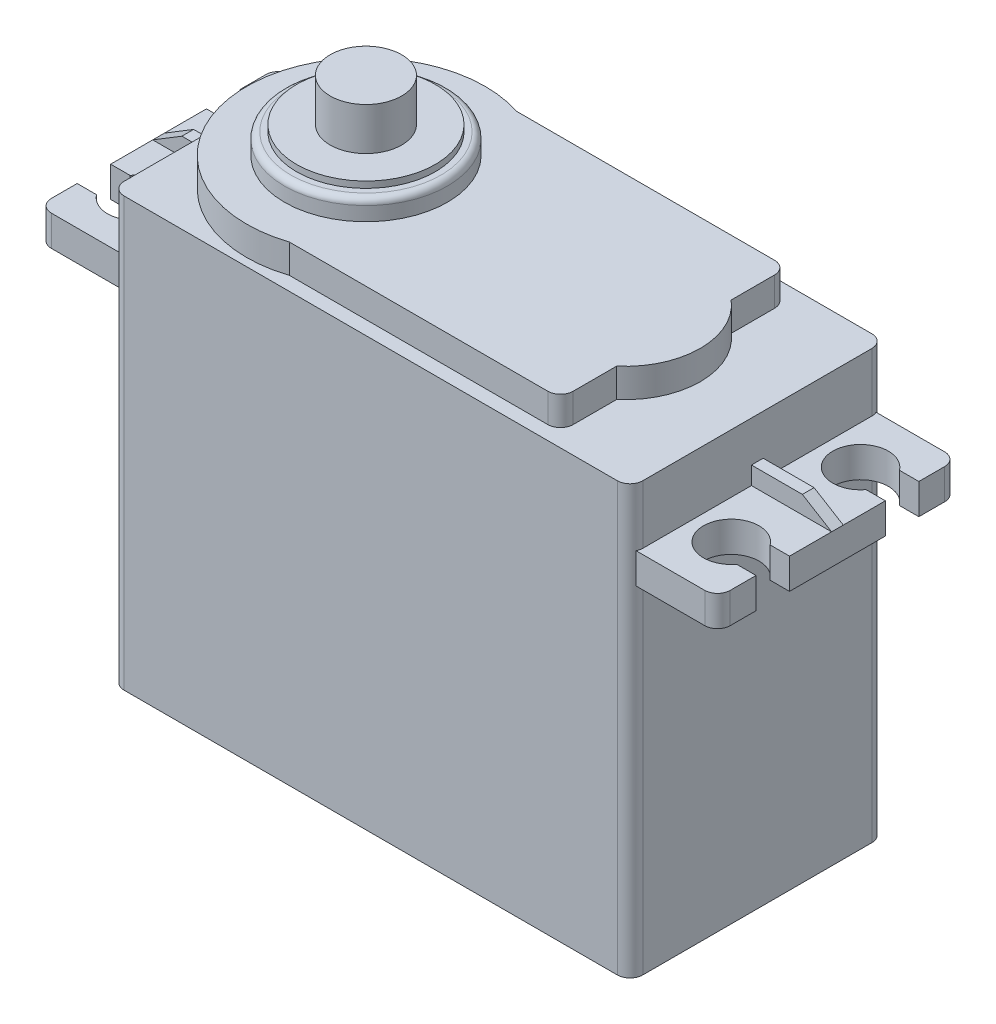
from build123d import *

# Parameters (mm, degrees)
SKETCH1_W            = 40.75
SKETCH1_H            = 33.63
BOSS_EXTRUDE1_DEPTH  = 10
BOSS_EXTRUDE2_DEPTH  = 2.27
SKETCH3_R            = 6.4
BOSS_EXTRUDE3_DEPTH  = 1.6
SKETCH4_R            = 5.45
BOSS_EXTRUDE4_DEPTH  = 0.5
SKETCH5_R            = 2.81
BOSS_EXTRUDE5_DEPTH  = 3.34
BOSS_EXTRUDE6_START  = -7
SKETCH6_W            = 6.295
SKETCH6_H            = 18.85
BOSS_EXTRUDE6_DEPTH  = 2.4
RIB1_START           = -0.46
RIB1_DEPTH           = 0.92
CUT_EXTRUDE2_REACH   = 42.67
MIRROR1_COPY_1_REACH = 42.67
FILLET2_R            = 1
FILLET3_R            = 0.5


# Read off the part's stored shape, not the designer's step: Rib1
with BuildPart() as part:
    # Sketch1 → Boss-Extrude1 (new, symmetric)
    with BuildSketch(Plane.XY):
        with Locations((0, 16.815)):
            Rectangle(SKETCH1_W, SKETCH1_H)
    extrude(amount=BOSS_EXTRUDE1_DEPTH, both=True)

    # Sketch2 → Boss-Extrude2 (add)
    with BuildSketch(Plane(origin=(0, 33.63, 0), x_dir=(1, 0, 0), z_dir=(0, 1, 0))):
        with BuildLine():
            Line((-7.459091051, -8.91), (13.82, -8.91))
            Line((13.82, -8.91), (13.82, -4.5))
            ThreePointArc((13.82, -4.5), (15.9, 0), (13.82, 4.5))
            Line((13.82, 4.5), (13.82, 8.91))
            Line((13.82, 8.91), (-7.459091051, 8.91))
            ThreePointArc((-7.459091051, 8.91), (-19.75, 0), (-7.459091051, -8.91))
        make_face()
    extrude(amount=BOSS_EXTRUDE2_DEPTH)

    # Sketch3 → Boss-Extrude3 (add)
    with BuildSketch(Plane(origin=(0, 35.9, 0), x_dir=(1, 0, 0), z_dir=(0, 1, 0))):
        with Locations(Location((-10.375, 0, 0), (0, 0, 270))):
            Circle(SKETCH3_R)
    extrude(amount=BOSS_EXTRUDE3_DEPTH)

    # Sketch4 → Boss-Extrude4 (add)
    with BuildSketch(Plane(origin=(0, 37.5, 0), x_dir=(1, 0, 0), z_dir=(0, 1, 0))):
        with Locations(Location((-10.375, 0, 0), (0, 0, 270))):
            Circle(SKETCH4_R)
    extrude(amount=BOSS_EXTRUDE4_DEPTH)

    # Sketch5 → Boss-Extrude5 (add)
    with BuildSketch(Plane(origin=(0, 38, 0), x_dir=(1, 0, 0), z_dir=(0, 1, 0))):
        with Locations(Location((-10.375, 0, 0), (0, 0, 270))):
            Circle(SKETCH5_R)
    extrude(amount=BOSS_EXTRUDE5_DEPTH)

    # Sketch6 → Boss-Extrude6 (add)
    with BuildSketch(Plane(origin=(0, 33.63, 0), x_dir=(1, 0, 0), z_dir=(0, 1, 0)).offset(BOSS_EXTRUDE6_START)):
        with Locations((23.5225, 0)):
            Rectangle(SKETCH6_W, SKETCH6_H)
    boss_extrude6 = extrude(amount=BOSS_EXTRUDE6_DEPTH)

    # Rib1 outline → Rib1 (add)
    with BuildSketch(Plane.XY.offset(RIB1_START)):
        Polygon((24.375, 30.43), (20.375, 30.43), (20.375, 29.03), (26.67, 29.03), align=None)
    rib1 = extrude(amount=RIB1_DEPTH)

    # Sketch10 → Cut-Extrude2 (cut, up to next)
    with BuildSketch(Plane(origin=(0, 29.03, 0), x_dir=(1, 0, 0), z_dir=(0, 1, 0)), mode=Mode.PRIVATE) as cut_extrude2_sk1:
        with BuildLine():
            Line((25.151241486, 6.395), (26.67, 6.395))
            Line((26.67, 6.395), (26.67, 3.765))
            Line((26.67, 3.765), (25.151241486, 3.765))
            ThreePointArc((25.151241486, 3.765), (21.2226, 5.08), (25.151241486, 6.395))
        make_face()
    cut_extrude2_tool1 = extrude(cut_extrude2_sk1.sketch, amount=-CUT_EXTRUDE2_REACH, mode=Mode.PRIVATE) & part.part
    cut_extrude2 = cut_extrude2_tool1.solids().sort_by_distance((23.873275, 29.03, -5.08))[0]
    add(cut_extrude2, mode=Mode.SUBTRACT)

    # Mirror2: Cut-Extrude2 across plane
    add(cut_extrude2.mirror(Plane.XY), mode=Mode.SUBTRACT)

    # Mirror1: Boss-Extrude6, Rib1, Cut-Extrude2 across plane
    add(boss_extrude6.mirror(Plane(origin=(0, 0, 0), x_dir=(0, 0, 1), z_dir=(1, 0, 0))))
    add(rib1.mirror(Plane(origin=(0, 0, 0), x_dir=(0, 0, 1), z_dir=(1, 0, 0))))
    add(cut_extrude2.mirror(Plane(origin=(0, 0, 0), x_dir=(0, 0, 1), z_dir=(1, 0, 0))), mode=Mode.SUBTRACT)

    # Mirror1 copy 1 sketch → Mirror1 copy 1 (cut, up to next)
    with BuildSketch(Plane(origin=(0, 29.03, 0), x_dir=(-1, 0, 0), z_dir=(0, 1, 0)), mode=Mode.PRIVATE) as mirror1_copy_1_sk1:
        with BuildLine():
            Line((25.151241486, 6.395), (26.67, 6.395))
            Line((26.67, 6.395), (26.67, 3.765))
            Line((26.67, 3.765), (25.151241486, 3.765))
            ThreePointArc((25.151241486, 3.765), (21.2226, 5.08), (25.151241486, 6.395))
        make_face()
    mirror1_copy_1_tool1 = extrude(mirror1_copy_1_sk1.sketch, amount=-MIRROR1_COPY_1_REACH, mode=Mode.PRIVATE) & part.part
    add(mirror1_copy_1_tool1.solids().sort_by_distance((-23.873275, 29.03, 5.08))[0], mode=Mode.SUBTRACT)

    # Fillet2
    # the kernel refuses this fillet: 1 mm, written as the material it takes off along each edge
    with BuildSketch(Plane(origin=(13.82, 33.63, -8.91), x_dir=(0, 0, 1), z_dir=(0, 1, 0)), Plane(origin=(13.82, 33.63, 8.91), x_dir=(-1, 0, 0), z_dir=(0, 1, 0))) as fillet2_piece_1:
        with BuildLine():
            CenterArc((FILLET2_R, -FILLET2_R), FILLET2_R, 90, 90)
            Line((0, -FILLET2_R), (0, 0))
            Line((0, 0), (FILLET2_R, 0))
        make_face()
    extrude(amount=4.77, mode=Mode.SUBTRACT)
    with BuildSketch(Plane(origin=(26.67, 24.13, 9.425), x_dir=(-1, 0, 0), z_dir=(0, 1, 0)), Plane(origin=(-26.67, 24.13, -9.425), x_dir=(1, 0, 0), z_dir=(0, 1, 0))) as fillet2_piece_2:
        with BuildLine():
            CenterArc((FILLET2_R, -FILLET2_R), FILLET2_R, 90, 90)
            Line((0, -FILLET2_R), (0, 0))
            Line((0, 0), (FILLET2_R, 0))
        make_face()
    extrude(amount=7.4, mode=Mode.SUBTRACT)
    with BuildSketch(Plane(origin=(26.67, 24.13, -9.425), x_dir=(-1, 0, 0), z_dir=(0, 1, 0)), Plane(origin=(-26.67, 24.13, 9.425), x_dir=(1, 0, 0), z_dir=(0, 1, 0))) as fillet2_piece_3:
        with BuildLine():
            CenterArc((FILLET2_R, FILLET2_R), FILLET2_R, 180, 90)
            Line((0, FILLET2_R), (0, 0))
            Line((0, 0), (FILLET2_R, 0))
        make_face()
    extrude(amount=7.4, mode=Mode.SUBTRACT)
    with BuildSketch(Plane(origin=(-20.375, 36.13, -10), x_dir=(1, 0, 0), z_dir=(0, -1, 0))) as fillet2_piece_4_section:
        with BuildLine():
            CenterArc((FILLET2_R, FILLET2_R), FILLET2_R, 180, 90)
            Line((0, FILLET2_R), (0, 0))
            Line((0, 0), (FILLET2_R, 0))
        make_face()
    fillet2_piece_4 = extrude(amount=38.63, mode=Mode.PRIVATE)
    fillet2_piece_4 = split(fillet2_piece_4, bisect_by=Plane(origin=(-20.12881047, 29.03, -9.819650702), z_dir=(0, 1, 0)), keep=Keep.TOP, mode=Mode.PRIVATE)
    fillet2_piece_4 = split(fillet2_piece_4, bisect_by=Plane(origin=(-20.12881047, 32.58, -9.425), z_dir=(0, 0, -1)), keep=Keep.TOP, mode=Mode.PRIVATE)
    add(fillet2_piece_4, mode=Mode.SUBTRACT)
    with BuildSketch(Plane(origin=(-20.375, 36.13, -10), x_dir=(1, 0, 0), z_dir=(0, -1, 0))) as fillet2_piece_5_section:
        with BuildLine():
            CenterArc((FILLET2_R, FILLET2_R), FILLET2_R, 180, 90)
            Line((0, FILLET2_R), (0, 0))
            Line((0, 0), (FILLET2_R, 0))
        make_face()
    fillet2_piece_5 = extrude(amount=38.63, mode=Mode.PRIVATE)
    fillet2_piece_5 = split(fillet2_piece_5, bisect_by=Plane(origin=(-20.361790059, 29.03, -9.277693036), z_dir=(0, 1, 0)), keep=Keep.TOP, mode=Mode.PRIVATE)
    fillet2_piece_5 = split(fillet2_piece_5, bisect_by=Plane(origin=(-20.361790059, 32.58, -9.425), z_dir=(0, 0, 1)), keep=Keep.TOP, mode=Mode.PRIVATE)
    add(fillet2_piece_5, mode=Mode.SUBTRACT)
    with BuildSketch(Plane(origin=(-20.375, 36.13, -10), x_dir=(1, 0, 0), z_dir=(0, -1, 0))) as fillet2_piece_6_section:
        with BuildLine():
            CenterArc((FILLET2_R, FILLET2_R), FILLET2_R, 180, 90)
            Line((0, FILLET2_R), (0, 0))
            Line((0, 0), (FILLET2_R, 0))
        make_face()
    fillet2_piece_6 = extrude(amount=38.63, mode=Mode.PRIVATE)
    fillet2_piece_6 = split(fillet2_piece_6, bisect_by=Plane(origin=(-20.12881047, 29.03, -9.819650702), z_dir=(0, -1, 0)), keep=Keep.TOP, mode=Mode.PRIVATE)
    fillet2_piece_6 = split(fillet2_piece_6, bisect_by=Plane(origin=(-20.12881047, 27.83, -9.425), z_dir=(0, 0, -1)), keep=Keep.TOP, mode=Mode.PRIVATE)
    fillet2_piece_6 = split(fillet2_piece_6, bisect_by=Plane(origin=(-20.12881047, 26.63, -9.819650702), z_dir=(0, 1, 0)), keep=Keep.TOP, mode=Mode.PRIVATE)
    add(fillet2_piece_6, mode=Mode.SUBTRACT)
    with BuildSketch(Plane(origin=(-20.375, 36.13, -10), x_dir=(1, 0, 0), z_dir=(0, -1, 0))) as fillet2_piece_7_section:
        with BuildLine():
            CenterArc((FILLET2_R, FILLET2_R), FILLET2_R, 180, 90)
            Line((0, FILLET2_R), (0, 0))
            Line((0, 0), (FILLET2_R, 0))
        make_face()
    fillet2_piece_7 = extrude(amount=38.63, mode=Mode.PRIVATE)
    fillet2_piece_7 = split(fillet2_piece_7, bisect_by=Plane(origin=(-20.12881047, 12.065, -9.425), z_dir=(0, 0, -1)), keep=Keep.TOP, mode=Mode.PRIVATE)
    fillet2_piece_7 = split(fillet2_piece_7, bisect_by=Plane(origin=(-20.12881047, 26.63, -9.819650702), z_dir=(0, -1, 0)), keep=Keep.TOP, mode=Mode.PRIVATE)
    add(fillet2_piece_7, mode=Mode.SUBTRACT)
    with BuildSketch(Plane(origin=(-20.375, 36.13, -10), x_dir=(1, 0, 0), z_dir=(0, -1, 0))) as fillet2_piece_8_section:
        with BuildLine():
            CenterArc((FILLET2_R, FILLET2_R), FILLET2_R, 180, 90)
            Line((0, FILLET2_R), (0, 0))
            Line((0, 0), (FILLET2_R, 0))
        make_face()
    fillet2_piece_8 = extrude(amount=38.63, mode=Mode.PRIVATE)
    fillet2_piece_8 = split(fillet2_piece_8, bisect_by=Plane(origin=(-20.361790059, 12.065, -9.425), z_dir=(0, 0, 1)), keep=Keep.TOP, mode=Mode.PRIVATE)
    fillet2_piece_8 = split(fillet2_piece_8, bisect_by=Plane(origin=(-20.361790059, 26.63, -9.277693036), z_dir=(0, -1, 0)), keep=Keep.TOP, mode=Mode.PRIVATE)
    add(fillet2_piece_8, mode=Mode.SUBTRACT)
    with BuildSketch(Plane(origin=(20.375, -2.5, -10), x_dir=(-1, 0, 0), z_dir=(0, 1, 0))) as fillet2_piece_9_section:
        with BuildLine():
            CenterArc((FILLET2_R, FILLET2_R), FILLET2_R, 180, 90)
            Line((0, FILLET2_R), (0, 0))
            Line((0, 0), (FILLET2_R, 0))
        make_face()
    fillet2_piece_9 = extrude(amount=38.63, mode=Mode.PRIVATE)
    fillet2_piece_9 = split(fillet2_piece_9, bisect_by=Plane(origin=(20.12881047, 12.065, -9.425), z_dir=(0, 0, -1)), keep=Keep.TOP, mode=Mode.PRIVATE)
    fillet2_piece_9 = split(fillet2_piece_9, bisect_by=Plane(origin=(20.12881047, 26.63, -9.819650702), z_dir=(0, -1, 0)), keep=Keep.TOP, mode=Mode.PRIVATE)
    add(fillet2_piece_9, mode=Mode.SUBTRACT)
    with BuildSketch(Plane(origin=(20.375, -2.5, -10), x_dir=(-1, 0, 0), z_dir=(0, 1, 0))) as fillet2_piece_10_section:
        with BuildLine():
            CenterArc((FILLET2_R, FILLET2_R), FILLET2_R, 180, 90)
            Line((0, FILLET2_R), (0, 0))
            Line((0, 0), (FILLET2_R, 0))
        make_face()
    fillet2_piece_10 = extrude(amount=38.63, mode=Mode.PRIVATE)
    fillet2_piece_10 = split(fillet2_piece_10, bisect_by=Plane(origin=(20.361790059, 12.065, -9.425), z_dir=(0, 0, 1)), keep=Keep.TOP, mode=Mode.PRIVATE)
    fillet2_piece_10 = split(fillet2_piece_10, bisect_by=Plane(origin=(20.361790059, 26.63, -9.277693036), z_dir=(0, -1, 0)), keep=Keep.TOP, mode=Mode.PRIVATE)
    add(fillet2_piece_10, mode=Mode.SUBTRACT)
    with BuildSketch(Plane(origin=(20.375, -2.5, -10), x_dir=(-1, 0, 0), z_dir=(0, 1, 0))) as fillet2_piece_11_section:
        with BuildLine():
            CenterArc((FILLET2_R, FILLET2_R), FILLET2_R, 180, 90)
            Line((0, FILLET2_R), (0, 0))
            Line((0, 0), (FILLET2_R, 0))
        make_face()
    fillet2_piece_11 = extrude(amount=38.63, mode=Mode.PRIVATE)
    fillet2_piece_11 = split(fillet2_piece_11, bisect_by=Plane(origin=(20.12881047, 27.83, -9.425), z_dir=(0, 0, -1)), keep=Keep.TOP, mode=Mode.PRIVATE)
    fillet2_piece_11 = split(fillet2_piece_11, bisect_by=Plane(origin=(20.12881047, 29.03, -9.819650702), z_dir=(0, -1, 0)), keep=Keep.TOP, mode=Mode.PRIVATE)
    fillet2_piece_11 = split(fillet2_piece_11, bisect_by=Plane(origin=(20.12881047, 26.63, -9.819650702), z_dir=(0, 1, 0)), keep=Keep.TOP, mode=Mode.PRIVATE)
    add(fillet2_piece_11, mode=Mode.SUBTRACT)
    with BuildSketch(Plane(origin=(20.375, -2.5, -10), x_dir=(-1, 0, 0), z_dir=(0, 1, 0))) as fillet2_piece_12_section:
        with BuildLine():
            CenterArc((FILLET2_R, FILLET2_R), FILLET2_R, 180, 90)
            Line((0, FILLET2_R), (0, 0))
            Line((0, 0), (FILLET2_R, 0))
        make_face()
    fillet2_piece_12 = extrude(amount=38.63, mode=Mode.PRIVATE)
    fillet2_piece_12 = split(fillet2_piece_12, bisect_by=Plane(origin=(20.12881047, 32.58, -9.425), z_dir=(0, 0, -1)), keep=Keep.TOP, mode=Mode.PRIVATE)
    fillet2_piece_12 = split(fillet2_piece_12, bisect_by=Plane(origin=(20.12881047, 29.03, -9.819650702), z_dir=(0, 1, 0)), keep=Keep.TOP, mode=Mode.PRIVATE)
    add(fillet2_piece_12, mode=Mode.SUBTRACT)
    with BuildSketch(Plane(origin=(20.375, -2.5, -10), x_dir=(-1, 0, 0), z_dir=(0, 1, 0))) as fillet2_piece_13_section:
        with BuildLine():
            CenterArc((FILLET2_R, FILLET2_R), FILLET2_R, 180, 90)
            Line((0, FILLET2_R), (0, 0))
            Line((0, 0), (FILLET2_R, 0))
        make_face()
    fillet2_piece_13 = extrude(amount=38.63, mode=Mode.PRIVATE)
    fillet2_piece_13 = split(fillet2_piece_13, bisect_by=Plane(origin=(20.361790059, 32.58, -9.425), z_dir=(0, 0, 1)), keep=Keep.TOP, mode=Mode.PRIVATE)
    fillet2_piece_13 = split(fillet2_piece_13, bisect_by=Plane(origin=(20.361790059, 29.03, -9.277693036), z_dir=(0, 1, 0)), keep=Keep.TOP, mode=Mode.PRIVATE)
    add(fillet2_piece_13, mode=Mode.SUBTRACT)
    with BuildSketch(Plane(origin=(20.375, -2.5, 10), x_dir=(0, 0, -1), z_dir=(0, 1, 0))) as fillet2_piece_14_section:
        with BuildLine():
            CenterArc((FILLET2_R, FILLET2_R), FILLET2_R, 180, 90)
            Line((0, FILLET2_R), (0, 0))
            Line((0, 0), (FILLET2_R, 0))
        make_face()
    fillet2_piece_14 = extrude(amount=38.63, mode=Mode.PRIVATE)
    fillet2_piece_14 = split(fillet2_piece_14, bisect_by=Plane(origin=(20.361790059, 12.065, 9.425), z_dir=(0, 0, -1)), keep=Keep.TOP, mode=Mode.PRIVATE)
    fillet2_piece_14 = split(fillet2_piece_14, bisect_by=Plane(origin=(20.361790059, 26.63, 9.277693036), z_dir=(0, -1, 0)), keep=Keep.TOP, mode=Mode.PRIVATE)
    add(fillet2_piece_14, mode=Mode.SUBTRACT)
    with BuildSketch(Plane(origin=(20.375, -2.5, 10), x_dir=(0, 0, -1), z_dir=(0, 1, 0))) as fillet2_piece_15_section:
        with BuildLine():
            CenterArc((FILLET2_R, FILLET2_R), FILLET2_R, 180, 90)
            Line((0, FILLET2_R), (0, 0))
            Line((0, 0), (FILLET2_R, 0))
        make_face()
    fillet2_piece_15 = extrude(amount=38.63, mode=Mode.PRIVATE)
    fillet2_piece_15 = split(fillet2_piece_15, bisect_by=Plane(origin=(20.12881047, 12.065, 9.425), z_dir=(0, 0, 1)), keep=Keep.TOP, mode=Mode.PRIVATE)
    fillet2_piece_15 = split(fillet2_piece_15, bisect_by=Plane(origin=(20.12881047, 26.63, 9.819650702), z_dir=(0, -1, 0)), keep=Keep.TOP, mode=Mode.PRIVATE)
    add(fillet2_piece_15, mode=Mode.SUBTRACT)
    with BuildSketch(Plane(origin=(20.375, -2.5, 10), x_dir=(0, 0, -1), z_dir=(0, 1, 0))) as fillet2_piece_16_section:
        with BuildLine():
            CenterArc((FILLET2_R, FILLET2_R), FILLET2_R, 180, 90)
            Line((0, FILLET2_R), (0, 0))
            Line((0, 0), (FILLET2_R, 0))
        make_face()
    fillet2_piece_16 = extrude(amount=38.63, mode=Mode.PRIVATE)
    fillet2_piece_16 = split(fillet2_piece_16, bisect_by=Plane(origin=(20.12881047, 29.03, 9.819650702), z_dir=(0, -1, 0)), keep=Keep.TOP, mode=Mode.PRIVATE)
    fillet2_piece_16 = split(fillet2_piece_16, bisect_by=Plane(origin=(20.12881047, 27.83, 9.425), z_dir=(0, 0, 1)), keep=Keep.TOP, mode=Mode.PRIVATE)
    fillet2_piece_16 = split(fillet2_piece_16, bisect_by=Plane(origin=(20.12881047, 26.63, 9.819650702), z_dir=(0, 1, 0)), keep=Keep.TOP, mode=Mode.PRIVATE)
    add(fillet2_piece_16, mode=Mode.SUBTRACT)
    with BuildSketch(Plane(origin=(20.375, -2.5, 10), x_dir=(0, 0, -1), z_dir=(0, 1, 0))) as fillet2_piece_17_section:
        with BuildLine():
            CenterArc((FILLET2_R, FILLET2_R), FILLET2_R, 180, 90)
            Line((0, FILLET2_R), (0, 0))
            Line((0, 0), (FILLET2_R, 0))
        make_face()
    fillet2_piece_17 = extrude(amount=38.63, mode=Mode.PRIVATE)
    fillet2_piece_17 = split(fillet2_piece_17, bisect_by=Plane(origin=(20.361790059, 29.03, 9.277693036), z_dir=(0, 1, 0)), keep=Keep.TOP, mode=Mode.PRIVATE)
    fillet2_piece_17 = split(fillet2_piece_17, bisect_by=Plane(origin=(20.361790059, 32.58, 9.425), z_dir=(0, 0, -1)), keep=Keep.TOP, mode=Mode.PRIVATE)
    add(fillet2_piece_17, mode=Mode.SUBTRACT)
    with BuildSketch(Plane(origin=(20.375, -2.5, 10), x_dir=(0, 0, -1), z_dir=(0, 1, 0))) as fillet2_piece_18_section:
        with BuildLine():
            CenterArc((FILLET2_R, FILLET2_R), FILLET2_R, 180, 90)
            Line((0, FILLET2_R), (0, 0))
            Line((0, 0), (FILLET2_R, 0))
        make_face()
    fillet2_piece_18 = extrude(amount=38.63, mode=Mode.PRIVATE)
    fillet2_piece_18 = split(fillet2_piece_18, bisect_by=Plane(origin=(20.12881047, 29.03, 9.819650702), z_dir=(0, 1, 0)), keep=Keep.TOP, mode=Mode.PRIVATE)
    fillet2_piece_18 = split(fillet2_piece_18, bisect_by=Plane(origin=(20.12881047, 32.58, 9.425), z_dir=(0, 0, 1)), keep=Keep.TOP, mode=Mode.PRIVATE)
    add(fillet2_piece_18, mode=Mode.SUBTRACT)
    with BuildSketch(Plane(origin=(-20.375, 36.13, 10), x_dir=(1, 0, 0), z_dir=(0, -1, 0))) as fillet2_piece_19_section:
        with BuildLine():
            CenterArc((FILLET2_R, -FILLET2_R), FILLET2_R, 90, 90)
            Line((0, -FILLET2_R), (0, 0))
            Line((0, 0), (FILLET2_R, 0))
        make_face()
    fillet2_piece_19 = extrude(amount=38.63, mode=Mode.PRIVATE)
    fillet2_piece_19 = split(fillet2_piece_19, bisect_by=Plane(origin=(-20.12881047, 32.58, 9.425), z_dir=(0, 0, 1)), keep=Keep.TOP, mode=Mode.PRIVATE)
    fillet2_piece_19 = split(fillet2_piece_19, bisect_by=Plane(origin=(-20.12881047, 29.03, 9.819650702), z_dir=(0, 1, 0)), keep=Keep.TOP, mode=Mode.PRIVATE)
    add(fillet2_piece_19, mode=Mode.SUBTRACT)
    with BuildSketch(Plane(origin=(-20.375, 36.13, 10), x_dir=(1, 0, 0), z_dir=(0, -1, 0))) as fillet2_piece_20_section:
        with BuildLine():
            CenterArc((FILLET2_R, -FILLET2_R), FILLET2_R, 90, 90)
            Line((0, -FILLET2_R), (0, 0))
            Line((0, 0), (FILLET2_R, 0))
        make_face()
    fillet2_piece_20 = extrude(amount=38.63, mode=Mode.PRIVATE)
    fillet2_piece_20 = split(fillet2_piece_20, bisect_by=Plane(origin=(-20.361790059, 32.58, 9.425), z_dir=(0, 0, -1)), keep=Keep.TOP, mode=Mode.PRIVATE)
    fillet2_piece_20 = split(fillet2_piece_20, bisect_by=Plane(origin=(-20.361790059, 29.03, 9.277693036), z_dir=(0, 1, 0)), keep=Keep.TOP, mode=Mode.PRIVATE)
    add(fillet2_piece_20, mode=Mode.SUBTRACT)
    with BuildSketch(Plane(origin=(-20.375, 36.13, 10), x_dir=(1, 0, 0), z_dir=(0, -1, 0))) as fillet2_piece_21_section:
        with BuildLine():
            CenterArc((FILLET2_R, -FILLET2_R), FILLET2_R, 90, 90)
            Line((0, -FILLET2_R), (0, 0))
            Line((0, 0), (FILLET2_R, 0))
        make_face()
    fillet2_piece_21 = extrude(amount=38.63, mode=Mode.PRIVATE)
    fillet2_piece_21 = split(fillet2_piece_21, bisect_by=Plane(origin=(-20.12881047, 27.83, 9.425), z_dir=(0, 0, 1)), keep=Keep.TOP, mode=Mode.PRIVATE)
    fillet2_piece_21 = split(fillet2_piece_21, bisect_by=Plane(origin=(-20.12881047, 29.03, 9.819650702), z_dir=(0, -1, 0)), keep=Keep.TOP, mode=Mode.PRIVATE)
    fillet2_piece_21 = split(fillet2_piece_21, bisect_by=Plane(origin=(-20.12881047, 26.63, 9.819650702), z_dir=(0, 1, 0)), keep=Keep.TOP, mode=Mode.PRIVATE)
    add(fillet2_piece_21, mode=Mode.SUBTRACT)
    with BuildSketch(Plane(origin=(-20.375, 36.13, 10), x_dir=(1, 0, 0), z_dir=(0, -1, 0))) as fillet2_piece_22_section:
        with BuildLine():
            CenterArc((FILLET2_R, -FILLET2_R), FILLET2_R, 90, 90)
            Line((0, -FILLET2_R), (0, 0))
            Line((0, 0), (FILLET2_R, 0))
        make_face()
    fillet2_piece_22 = extrude(amount=38.63, mode=Mode.PRIVATE)
    fillet2_piece_22 = split(fillet2_piece_22, bisect_by=Plane(origin=(-20.12881047, 12.065, 9.425), z_dir=(0, 0, 1)), keep=Keep.TOP, mode=Mode.PRIVATE)
    fillet2_piece_22 = split(fillet2_piece_22, bisect_by=Plane(origin=(-20.12881047, 26.63, 9.819650702), z_dir=(0, -1, 0)), keep=Keep.TOP, mode=Mode.PRIVATE)
    add(fillet2_piece_22, mode=Mode.SUBTRACT)
    with BuildSketch(Plane(origin=(-20.375, 36.13, 10), x_dir=(1, 0, 0), z_dir=(0, -1, 0))) as fillet2_piece_23_section:
        with BuildLine():
            CenterArc((FILLET2_R, -FILLET2_R), FILLET2_R, 90, 90)
            Line((0, -FILLET2_R), (0, 0))
            Line((0, 0), (FILLET2_R, 0))
        make_face()
    fillet2_piece_23 = extrude(amount=38.63, mode=Mode.PRIVATE)
    fillet2_piece_23 = split(fillet2_piece_23, bisect_by=Plane(origin=(-20.361790059, 12.065, 9.425), z_dir=(0, 0, -1)), keep=Keep.TOP, mode=Mode.PRIVATE)
    fillet2_piece_23 = split(fillet2_piece_23, bisect_by=Plane(origin=(-20.361790059, 26.63, 9.277693036), z_dir=(0, -1, 0)), keep=Keep.TOP, mode=Mode.PRIVATE)
    add(fillet2_piece_23, mode=Mode.SUBTRACT)

    # Fillet3
    fillet3_edges = [part.edges().sort_by_distance(p)[0] for p in [
        (-10.375, 37.5, -6.4),
    ]]
    fillet(fillet3_edges, radius=FILLET3_R)


solid = part.part
